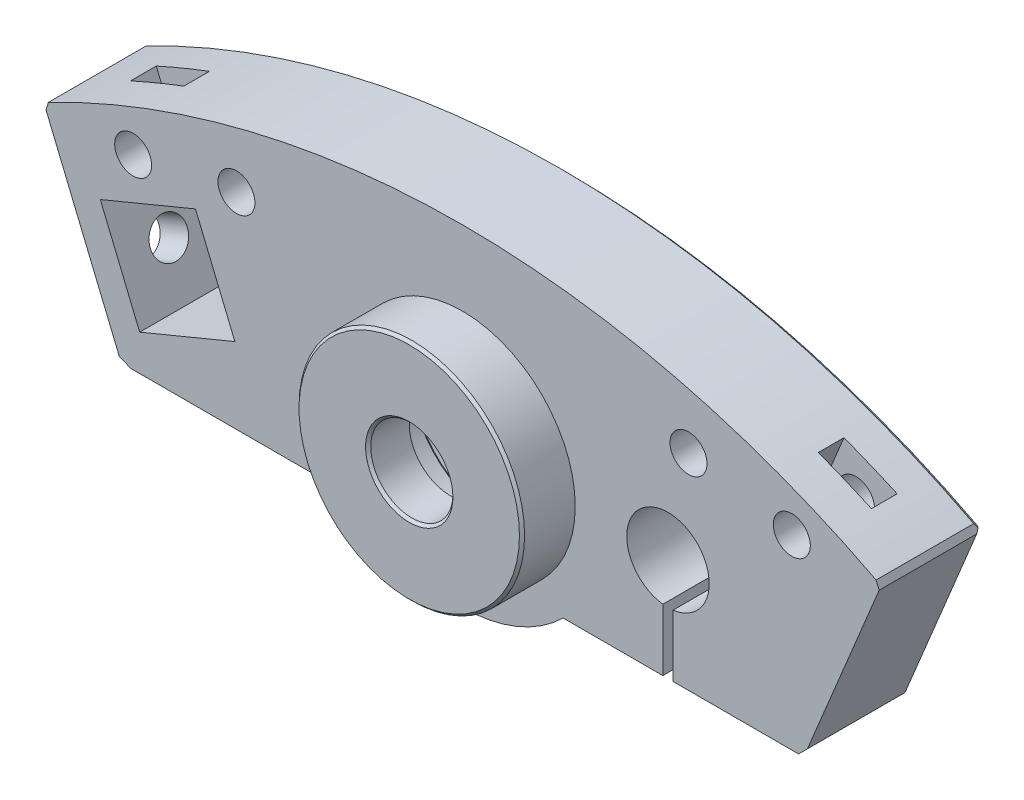
from build123d import *

# Parameters (mm, degrees)
SKETCH1_R           = 5
SKETCH1_R_2         = 1.8
BOSS_EXTRUDE1_DEPTH = 10
CHAMFER1_SIZE       = 0.5
CUT_EXTRUDE2_DEPTH  = 2.5
CHAMFER2_SIZE       = 0.5
SKETCH4_R           = 1.8
CUT_EXTRUDE3_DEPTH  = 10
CHAMFER3_SIZE       = 0.5
CHAMFER3_SIZE_2     = 0.923879533
CHAMFER3_SIZE_3     = 0.552958444
SKETCH7_R           = 10.975
SKETCH7_R_2         = 4
BOSS_EXTRUDE2_DEPTH = 5.18
SKETCH8_R           = 8.5125
CUT_EXTRUDE6_DEPTH  = 11.18
SKETCH9_R           = 9.5125
CUT_EXTRUDE8_DEPTH  = 6.32
CHAMFER4_SIZE       = 0.25


with BuildPart() as part:
    # Sketch1 → Boss-Extrude1 (new body)
    with BuildSketch(Plane.XY):
        with BuildLine():
            Line((-40.746699048, 8.183561953), (-33.214821075, -10))
            Line((-33.214821075, -10), (-9.797958971, -10))
            ThreePointArc((-9.797958971, -10), (0, -14), (9.797958971, -10))
            Line((9.797958971, -10), (19.5, -10))
            Line((19.5, -10), (19.5, -3.981225471))
            ThreePointArc((19.5, -3.981225471), (20, 4.0125), (20.5, -3.981225471))
            Line((20.5, -3.981225471), (20.5, -10))
            Line((20.5, -10), (33.214821075, -10))
            Line((33.214821075, -10), (40.746699048, 8.183561953))
            ThreePointArc((40.746699048, 8.183561953), (0, 18.25), (-40.746699048, 8.183561953))
        make_face()
        Circle(SKETCH1_R, mode=Mode.SUBTRACT)
        with Locations((-32.052211881, 8.130884627)):
            Circle(SKETCH1_R_2, mode=Mode.SUBTRACT)
        with Locations(Location((32.052211881, 8.130884627, 0), (0, 0, 180))):
            Circle(SKETCH1_R_2, mode=Mode.SUBTRACT)
        with Locations((-22, 10)):
            Circle(SKETCH1_R_2, mode=Mode.SUBTRACT)
        with Locations(Location((22, 10, 0), (0, 0, 180))):
            Circle(SKETCH1_R_2, mode=Mode.SUBTRACT)
        Polygon((-25.988511975, 6.5901118), (-35.250404289, 2.75371039), (-31.414002879, -6.508181923), (-22.152110566, -2.671780514), align=None, mode=Mode.SUBTRACT)
    extrude(amount=BOSS_EXTRUDE1_DEPTH)

    # Chamfer1
    chamfer1_edges = [part.edges().sort_by_distance(p)[0] for p in [
        (20, 4.0125, 0),
        (-24.070311271, 1.959165643, 0),
        (-30.619458132, 4.671911095, 0),
        (-33.332203584, -1.877235766, 0),
        (-26.783056723, -4.589981218, 0),
    ]]
    chamfer(chamfer1_edges, length=CHAMFER1_SIZE)

    # Sketch3 → Cut-Extrude2 (cut)
    with BuildSketch(Plane.XY.offset(3.75)):
        Polygon((-37.076762037, 12.944469155), (-33.567560961, 4.472508325), (-28.393835579, 6.615535546), (-31.903036655, 15.087496376), align=None)
        Polygon((37.076762037, 12.944469155), (33.567560961, 4.472508325), (28.393835579, 6.615535546), (31.903036655, 15.087496376), align=None)
    extrude(amount=CUT_EXTRUDE2_DEPTH, mode=Mode.SUBTRACT)

    # Chamfer2
    chamfer2_edges = [part.edges().sort_by_distance(p)[0] for p in [
        (14.648979486, -10, 0),
        (0, -14, 0),
        (-21.506390023, -10, 0),
        (-36.980760062, -0.908219024, 0),
        (0, 18.25, 0),
        (36.980760062, -0.908219024, 0),
        (26.857410538, -10, 0),
    ]]
    chamfer(chamfer2_edges, length=CHAMFER2_SIZE)

    # Sketch4 → Cut-Extrude3 (cut)
    with BuildSketch(Plane(origin=(-29.114518455, -12.059628406, 0), x_dir=(0, 0, -1), z_dir=(0.9238795325112882, 0.38268343236508634, 0))):
        with Locations(Location((-5.25, 11.021342374, 0), (0, 0, 90))):
            Circle(SKETCH4_R)
    extrude(amount=-CUT_EXTRUDE3_DEPTH, mode=Mode.SUBTRACT)

    # Chamfer3
    # the kernel refuses this chamfer: 0.923879533, 0.552958444, 0.5 mm, written as the material it takes off along each edge
    with BuildSketch(Plane(origin=(40.746699048, 8.183561953, -0.920037939), x_dir=(-0.38268343236508906, -0.923879532511287, 0), z_dir=(0, 0, 1))) as chamfer3_piece_1:
        with BuildLine():
            Line((CHAMFER3_SIZE, 0), (-0.048717445, -0.548717445))
            ThreePointArc((-0.048717445, -0.548717445), (-0.025540103, -0.282767493), (0, 0))
            Line((0, 0), (CHAMFER3_SIZE, 0))
        make_face()
    extrude(amount=12.340075878, mode=Mode.SUBTRACT)
    with BuildSketch(Plane(origin=(33.214821075, -10, -1.895315111), x_dir=(-1, 0, 0), z_dir=(0, 0, 1)), Plane(origin=(-33.214821075, -10, -1.895315111), x_dir=(-0.38268343236508656, 0.9238795325112881, 0), z_dir=(0, 0, 1))) as chamfer3_piece_2:
        Polygon((CHAMFER3_SIZE, 0), (-CHAMFER3_SIZE_2 * 0.382683432163, -CHAMFER3_SIZE_2 * 0.923879532023), (0, 0), align=None)
    extrude(amount=14.290630221, mode=Mode.SUBTRACT)
    with BuildSketch(Plane(origin=(-40.746699048, 8.183561953, -0.925350902), x_dir=(0.38268343236508684, -0.9238795325112881, 0), z_dir=(0, 0, 1))) as chamfer3_piece_3:
        with BuildLine():
            Line((CHAMFER3_SIZE_3, 0), (-0.04424113, 0.496614821))
            ThreePointArc((-0.04424113, 0.496614821), (-0.0231658, 0.256042208), (0, 0))
            Line((0, 0), (CHAMFER3_SIZE_3, 0))
        make_face()
    extrude(amount=12.350701805, mode=Mode.SUBTRACT)

    # Sketch7 → Boss-Extrude2 (add)
    with BuildSketch(Plane.XY.offset(10)):
        Circle(SKETCH7_R)
        Circle(SKETCH7_R_2, mode=Mode.SUBTRACT)
    extrude(amount=BOSS_EXTRUDE2_DEPTH)

    # Sketch8 → Cut-Extrude6 (cut)
    with BuildSketch(Plane.XY):
        with Locations(Location((0, 0, 0), (0, 0, 180))):
            Circle(SKETCH8_R)
    extrude(amount=CUT_EXTRUDE6_DEPTH, mode=Mode.SUBTRACT)

    # Sketch9 → Cut-Extrude8 (cut)
    with BuildSketch(Plane.XY):
        with Locations(Location((0, 0, 0), (0, 0, 180))):
            Circle(SKETCH9_R)
    extrude(amount=CUT_EXTRUDE8_DEPTH, mode=Mode.SUBTRACT)

    # Chamfer4
    chamfer4_edges = [part.edges().sort_by_distance(p)[0] for p in [
        (-10.975, 0, 15.18),
        (-4, 0, 15.18),
        (8.5125, 0, 6.32),
    ]]
    chamfer(chamfer4_edges, length=CHAMFER4_SIZE)


solid = part.part
